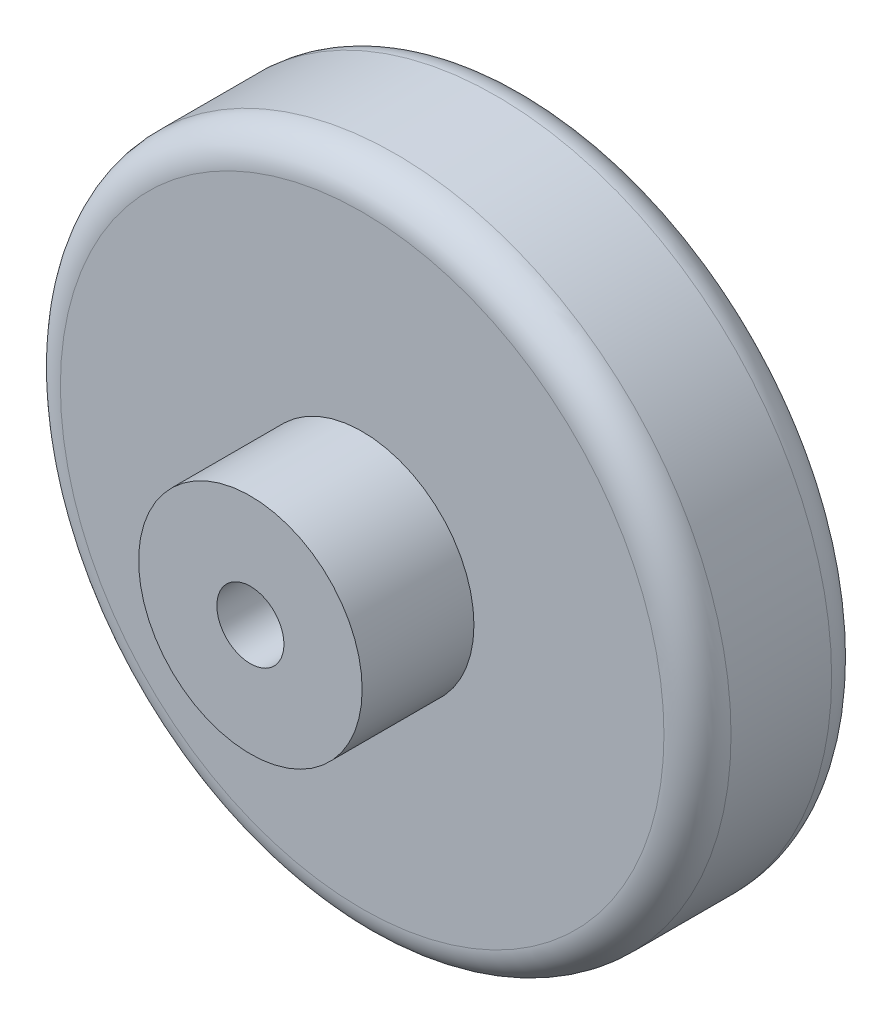
from build123d import *

# Parameters (mm, degrees)
SKETCH1_R           = 30
BOSS_EXTRUDE1_DEPTH = 15
SKETCH2_R           = 10
BOSS_EXTRUDE2_DEPTH = 10
SKETCH3_R           = 3
CUT_EXTRUDE1_DEPTH  = 50.244289009
FILLET1_R           = 3
SKETCH4_R           = 6
CUT_EXTRUDE2_DEPTH  = 4
FILLET2_R           = 1


with BuildPart() as part:
    # Sketch1 → Boss-Extrude1 (new body)
    with BuildSketch(Plane.XY):
        Circle(SKETCH1_R)
    extrude(amount=BOSS_EXTRUDE1_DEPTH)

    # Sketch2 → Boss-Extrude2 (add)
    with BuildSketch(Plane.XY.offset(15)):
        Circle(SKETCH2_R)
    extrude(amount=BOSS_EXTRUDE2_DEPTH)

    # Sketch3 → Cut-Extrude1 (cut, through all)
    with BuildSketch(Plane.XY.offset(25)):
        Circle(SKETCH3_R)
    extrude(amount=-CUT_EXTRUDE1_DEPTH, mode=Mode.SUBTRACT)

    # Fillet1
    fillet1_edges = [part.edges().sort_by_distance(p)[0] for p in [
        (-30, 0, 0),
        (-30, 0, 15),
    ]]
    fillet(fillet1_edges, radius=FILLET1_R)

    # Sketch4 → Cut-Extrude2 (cut)
    with BuildSketch(Plane(origin=(0, 0, 0), x_dir=(-1, 0, 0), z_dir=(0, 0, -1))):
        Circle(SKETCH4_R)
    extrude(amount=-CUT_EXTRUDE2_DEPTH, mode=Mode.SUBTRACT)

    # Fillet2
    fillet2_edges = [part.edges().sort_by_distance(p)[0] for p in [
        (6, 0, 0),
    ]]
    fillet(fillet2_edges, radius=FILLET2_R)


solid = part.part
